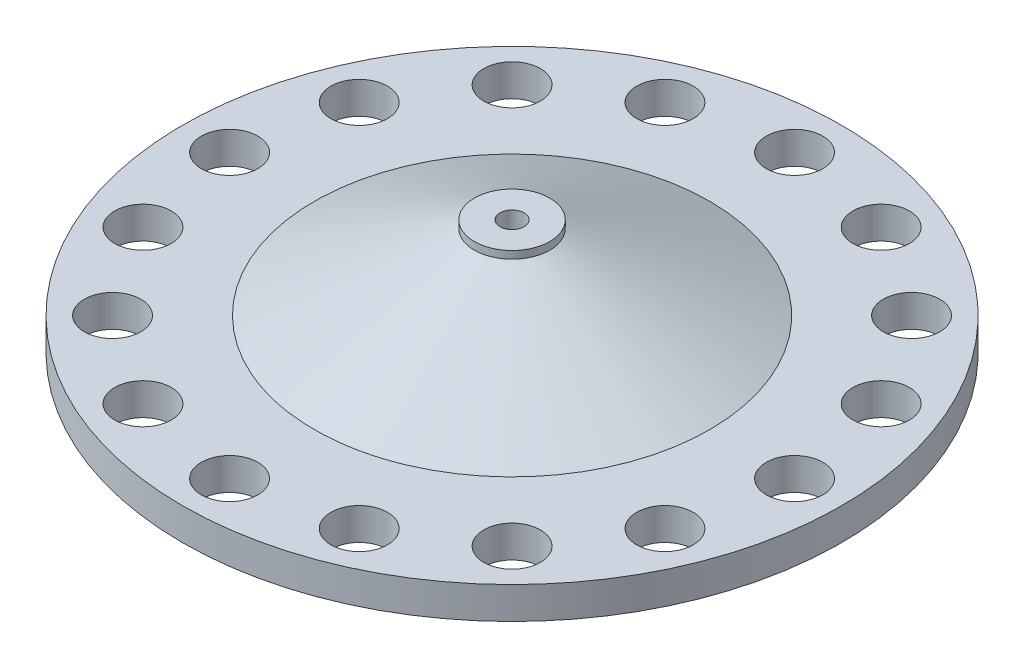
from build123d import *

# Parameters (mm, degrees)
SKETCH2_R           = 175
BOSS_EXTRUDE1_DEPTH = 17
SKETCH5_R           = 15
CUT_EXTRUDE1_DEPTH  = 17
SKETCH6_R           = 20
BOSS_EXTRUDE2_DEPTH = 4
SKETCH7_R           = 6.4
CUT_EXTRUDE2_DEPTH  = 255.894095793


with BuildPart() as part:
    # Sketch2 → Boss-Extrude1 (new body)
    with BuildSketch(Plane(origin=(0, 0, 0), x_dir=(1, 0, 0), z_dir=(0, 1, 0))):
        with Locations(Location((0, 0, 0), (0, 0, 270))):
            Circle(SKETCH2_R)
    extrude(amount=BOSS_EXTRUDE1_DEPTH)

    # Loft1: read off the stored shape, not the designer's step
    # Loft1: loft between two sections, ruled curve by curve
    loft1_from = [
        Edge.make_bspline([(4.642258143, 57, -19.453776994), (43.549812131, 57, -10.169260708), (34.265295845, 57, 28.73829328), (-4.642258143, 57, 19.453776994), (-43.549812131, 57, 10.169260708), (-34.265295845, 57, -28.73829328), (4.642258143, 57, -19.453776994)], [0, 0, 0, 0, 0.5, 0.5, 0.5, 1, 1, 1, 1], 3, [1, 0.333333333, 0.333333333, 1, 0.333333333, 0.333333333, 1]),
    ]
    loft1_to = [
        Edge.make_bspline([(0.659730116, 17, -104.99792739), (210.655584896, 17, -103.678467157), (209.336124663, 17, 106.317387623), (-0.659730116, 17, 104.99792739), (-210.655584896, 17, 103.678467157), (-209.336124663, 17, -106.317387623), (0.659730116, 17, -104.99792739)], [0, 0, 0, 0, 0.5, 0.5, 0.5, 1, 1, 1, 1], 3, [1, 0.333333333, 0.333333333, 1, 0.333333333, 0.333333333, 1]),
    ]
    loft1 = Solid(Shell([*[Face.make_surface_from_curves(loft1_from[k], loft1_to[k]) for k in range(1)], Face(Wire(loft1_from)), Face(Wire(loft1_to))]))
    add(loft1)

    # Sketch5 → Cut-Extrude1 (cut)
    with BuildSketch(Plane(origin=(0, 17, 0), x_dir=(1, 0, 0), z_dir=(0, 1, 0))):
        with Locations(Location((-150, 0, 0), (0, 0, 270))):
            Circle(SKETCH5_R)
        with Locations(Location((-138.581929877, 57.402514855, 0), (0, 0, 270))):
            Circle(SKETCH5_R)
        with Locations(Location((-106.066017178, 106.066017178, 0), (0, 0, 270))):
            Circle(SKETCH5_R)
        with Locations(Location((-57.402514855, 138.581929877, 0), (0, 0, 270))):
            Circle(SKETCH5_R)
        with Locations(Location((0, 150, 0), (0, 0, 270))):
            Circle(SKETCH5_R)
        with Locations(Location((57.402514855, 138.581929877, 0), (0, 0, 270))):
            Circle(SKETCH5_R)
        with Locations(Location((106.066017178, 106.066017178, 0), (0, 0, 270))):
            Circle(SKETCH5_R)
        with Locations(Location((138.581929877, 57.402514855, 0), (0, 0, 270))):
            Circle(SKETCH5_R)
        with Locations(Location((150, 0, 0), (0, 0, 270))):
            Circle(SKETCH5_R)
        with Locations(Location((138.581929877, -57.402514855, 0), (0, 0, 270))):
            Circle(SKETCH5_R)
        with Locations(Location((106.066017178, -106.066017178, 0), (0, 0, 270))):
            Circle(SKETCH5_R)
        with Locations(Location((57.402514855, -138.581929877, 0), (0, 0, 270))):
            Circle(SKETCH5_R)
        with Locations(Location((0, -150, 0), (0, 0, 270))):
            Circle(SKETCH5_R)
        with Locations(Location((-57.402514855, -138.581929877, 0), (0, 0, 270))):
            Circle(SKETCH5_R)
        with Locations(Location((-106.066017178, -106.066017178, 0), (0, 0, 270))):
            Circle(SKETCH5_R)
        with Locations(Location((-138.581929877, -57.402514855, 0), (0, 0, 270))):
            Circle(SKETCH5_R)
    extrude(amount=-CUT_EXTRUDE1_DEPTH, mode=Mode.SUBTRACT)

    # Sketch6 → Boss-Extrude2 (add)
    with BuildSketch(Plane(origin=(0, 57, 0), x_dir=(1, 0, 0), z_dir=(0, 1, 0))):
        with Locations(Location((0, 0, 0), (0, 0, 76.578500593))):
            Circle(SKETCH6_R)
    extrude(amount=BOSS_EXTRUDE2_DEPTH)

    # Sketch7 → Cut-Extrude2 (cut, through all)
    with BuildSketch(Plane(origin=(0, 61, 0), x_dir=(1, 0, 0), z_dir=(0, 1, 0))):
        with Locations(Location((0, 0, 0), (0, 0, 270))):
            Circle(SKETCH7_R)
    extrude(amount=-CUT_EXTRUDE2_DEPTH, mode=Mode.SUBTRACT)


solid = part.part
